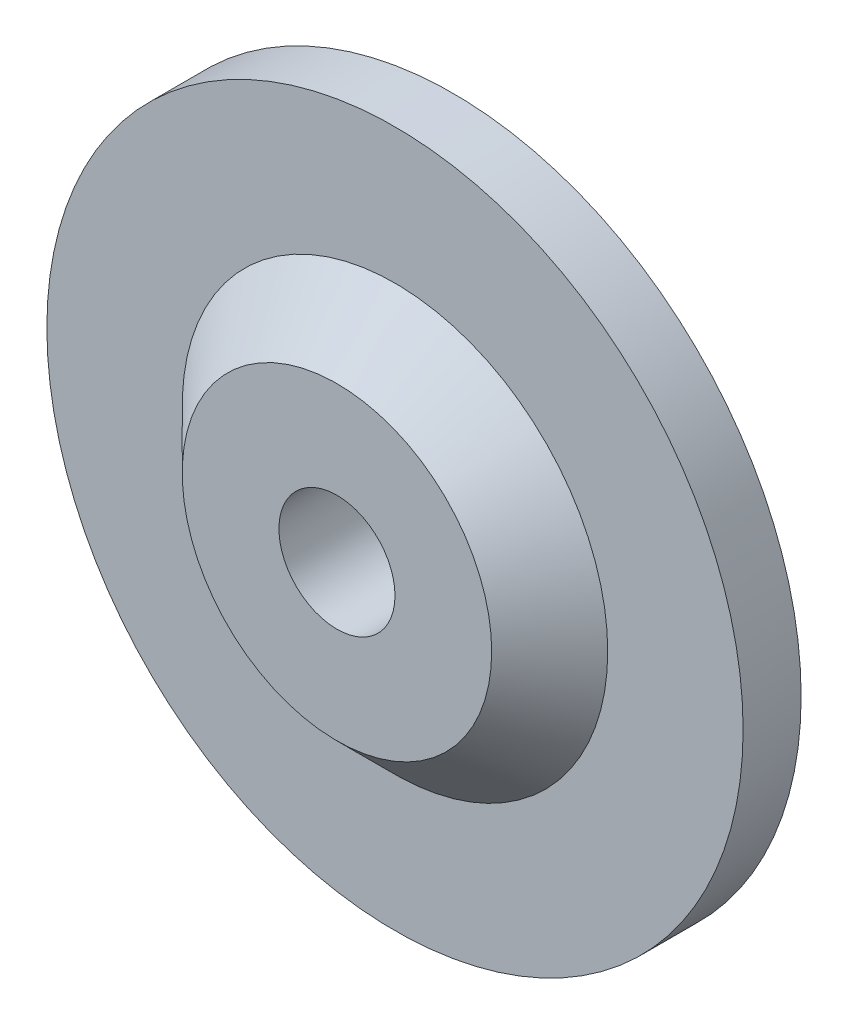
from build123d import *

# Parameters (mm, degrees)
ESQUISSE1_R        = 18
ESQUISSE1_R_2      = 3
BOSS_EXTRU_1_DEPTH = 3
ESQUISSE2_R        = 13
ESQUISSE2_R_2      = 3
BOSS_EXTRU_2_DEPTH = 3
CHANFREIN1_SIZE    = 5


with BuildPart() as part:
    # Esquisse1 → Boss.-Extru.1 (new body)
    with BuildSketch(Plane.XY):
        Circle(ESQUISSE1_R)
        Circle(ESQUISSE1_R_2, mode=Mode.SUBTRACT)
    extrude(amount=BOSS_EXTRU_1_DEPTH)

    # Esquisse2 → Boss.-Extru.2 (add)
    with BuildSketch(Plane.XY.offset(3)):
        Circle(ESQUISSE2_R)
        Circle(ESQUISSE2_R_2, mode=Mode.SUBTRACT)
    extrude(amount=BOSS_EXTRU_2_DEPTH)

    # Chanfrein1
    # the kernel refuses this chamfer: 5 mm, written as the material it takes off along each edge
    with BuildSketch(Plane(origin=(0, 0, 6), x_dir=(1, 0, 0), z_dir=(0, -1, 0))) as chanfrein1_piece_1_section:
        Polygon((13, -CHANFREIN1_SIZE), (13 - CHANFREIN1_SIZE, 0), (13, 0), align=None)
    chanfrein1_piece_1 = revolve(axis=Axis((0, 0, 6), (0, 0, 1)), mode=Mode.PRIVATE)
    chanfrein1_piece_1 = split(chanfrein1_piece_1, bisect_by=Plane(origin=(-9.494850826, 0, 3), z_dir=(0, 0, 1)), keep=Keep.TOP, mode=Mode.PRIVATE)
    add(chanfrein1_piece_1, mode=Mode.SUBTRACT)


solid = part.part
